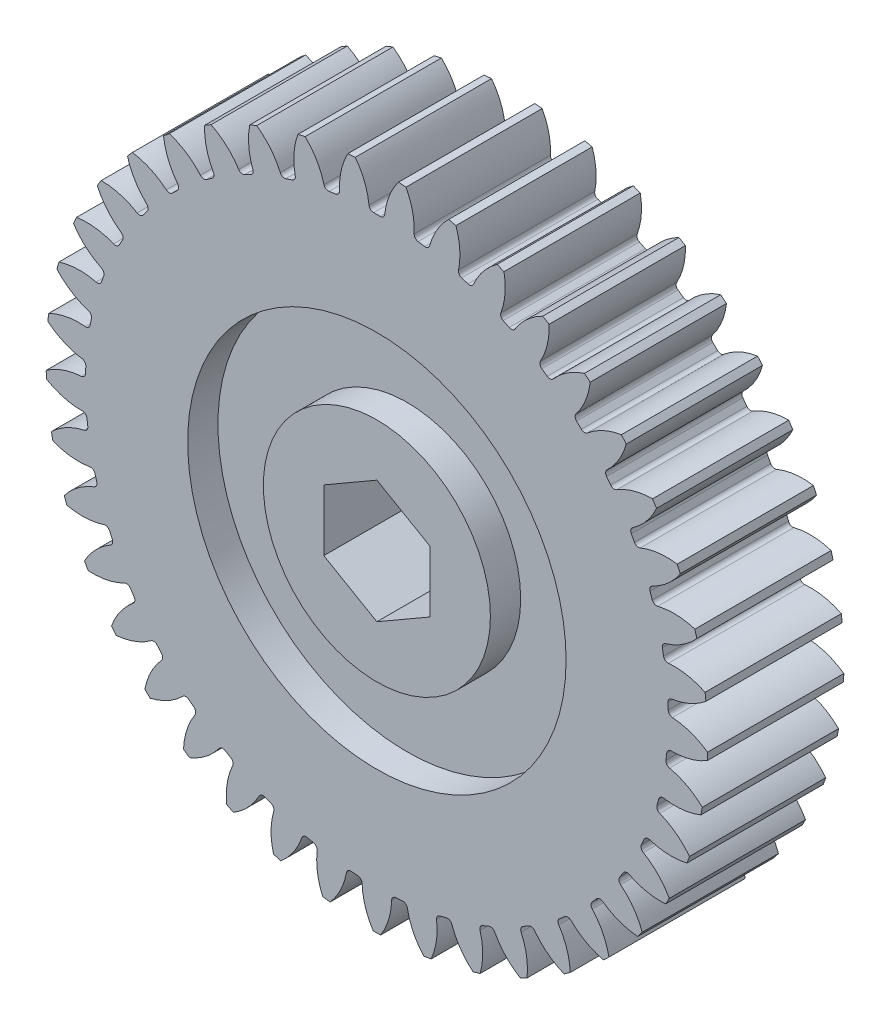
from build123d import *

# Parameters (mm, degrees)
SKIZZE1_R                       = 21.853
AUFSATZ_LINEAR_AUSTRAGEN1_DEPTH = 4.5
SKIZZE4_R                       = 12.5
SKIZZE4_R_2                     = 7.5
SCHNITT_LINEAR_AUSTRAGEN2_DEPTH = 2
SCHNITT_LINEAR_AUSTRAGEN3_DEPTH = 33.188619386
KREISMUSTER1_COUNT              = 41
SKIZZE8_R                       = 6
AUFSATZ_LINEAR_AUSTRAGEN2_DEPTH = 1
SCHNITT_LINEAR_AUSTRAGEN4_DEPTH = 33.47704342


with BuildPart() as part:
    # Skizze1 → Aufsatz-Linear austragen1 (new, symmetric)
    with BuildSketch(Plane.XY):
        Circle(SKIZZE1_R)
    extrude(amount=AUFSATZ_LINEAR_AUSTRAGEN1_DEPTH, both=True)

    # Skizze4 → Schnitt-Linear austragen2 (cut)
    with BuildSketch(Plane.XY.offset(4.5)):
        Circle(SKIZZE4_R)
        Circle(SKIZZE4_R_2, mode=Mode.SUBTRACT)
    extrude(amount=-SCHNITT_LINEAR_AUSTRAGEN2_DEPTH, mode=Mode.SUBTRACT)

    # Skizze6 → Schnitt-Linear austragen3 (cut, through all)
    with BuildSketch(Plane.XY.offset(4.5)):
        with BuildLine():
            Line((-0.221730524, 19.25), (0.221730524, 19.25))
            ThreePointArc((0.221730524, 19.25), (0.42252647, 19.327107676), (0.520103024, 19.518793414))
            ThreePointArc((0.520103024, 19.518793414), (1.015033633, 21.15853046), (2.08, 22.5))
            ThreePointArc((2.08, 22.5), (0, 22.620581665), (-2.08, 22.5))
            ThreePointArc((-2.08, 22.5), (-1.015033633, 21.15853046), (-0.520103024, 19.518793414))
            ThreePointArc((-0.520103024, 19.518793414), (-0.42252647, 19.327107676), (-0.221730524, 19.25))
        make_face()
    schnitt_linear_austragen3 = extrude(amount=-SCHNITT_LINEAR_AUSTRAGEN3_DEPTH, mode=Mode.SUBTRACT)

    # Kreismuster1: Schnitt-Linear austragen3 ×41 about axis
    kreismuster1_axis = Axis((0, 0, 2.5), (0, 0, 1))
    for i in range(1, KREISMUSTER1_COUNT):
        add(schnitt_linear_austragen3.rotate(kreismuster1_axis, i * 360 / KREISMUSTER1_COUNT), mode=Mode.SUBTRACT)

    # Skizze8 → Aufsatz-Linear austragen2 (add)
    with BuildSketch(Plane(origin=(0, 0, -4.5), x_dir=(-1, 0, 0), z_dir=(0, 0, -1))):
        Circle(SKIZZE8_R)
    extrude(amount=AUFSATZ_LINEAR_AUSTRAGEN2_DEPTH)

    # Skizze7 → Schnitt-Linear austragen4 (cut, through all)
    with BuildSketch(Plane.XY.offset(4.5)):
        Polygon((0, 4.05), (-3.507402885, 2.025), (-3.507402885, -2.025), (0, -4.05), (3.507402885, -2.025), (3.507402885, 2.025), align=None)
    extrude(amount=-SCHNITT_LINEAR_AUSTRAGEN4_DEPTH, mode=Mode.SUBTRACT)


solid = part.part
